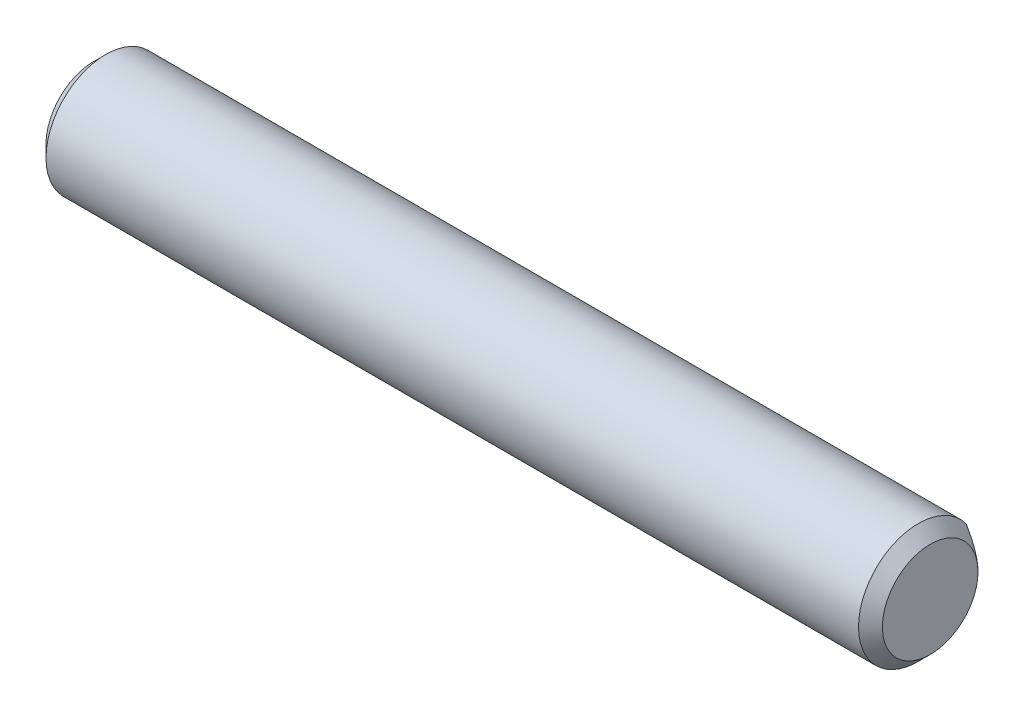
from build123d import *

# Parameters (mm, degrees)
SKETCH1_W          = 35
SKETCH1_H          = 2.5
CUT_EXTRUDE1_START = -8
CUT_EXTRUDE1_DEPTH = 8
CUT_EXTRUDE2_DEPTH = 8
CHAMFER1_SIZE      = 0.5


with BuildPart() as part:
    # Sketch1 → Revolve1 (revolve)
    with BuildSketch(Plane(origin=(0, 0, 0), x_dir=(1, 0, 0), z_dir=(0, 1, 0))):
        with Locations((-17.5, 1.25)):
            Rectangle(SKETCH1_W, SKETCH1_H)
    revolve(axis=Axis((0, 0, 0), (-1, 0, 0)))

    # Sketch2 → Cut-Extrude1 (cut)
    with BuildSketch(Plane.ZY.offset(35).offset(CUT_EXTRUDE1_START)):
        with BuildLine():
            Line((-2, 1.5), (-2, -1.5))
            ThreePointArc((-2, -1.5), (-2.5, 0), (-2, 1.5))
        make_face()
    extrude(amount=CUT_EXTRUDE1_DEPTH, mode=Mode.SUBTRACT)

    # Sketch3 → Cut-Extrude2 (cut)
    with BuildSketch(Plane(origin=(0, 0, 0), x_dir=(0, 0, -1), z_dir=(1, 0, 0))):
        with BuildLine():
            Line((2, 1.5), (2, -1.5))
            ThreePointArc((2, -1.5), (2.5, 0), (2, 1.5))
        make_face()
    extrude(amount=-CUT_EXTRUDE2_DEPTH, mode=Mode.SUBTRACT)

    # Chamfer1
    chamfer1_edges = [part.edges().sort_by_distance(p)[0] for p in [
        (0, 0, 2.5),
        (-35, 0, 2.5),
    ]]
    chamfer(chamfer1_edges, length=CHAMFER1_SIZE - 0.0001)  # a hair under: the kernel refuses the full size


solid = part.part
